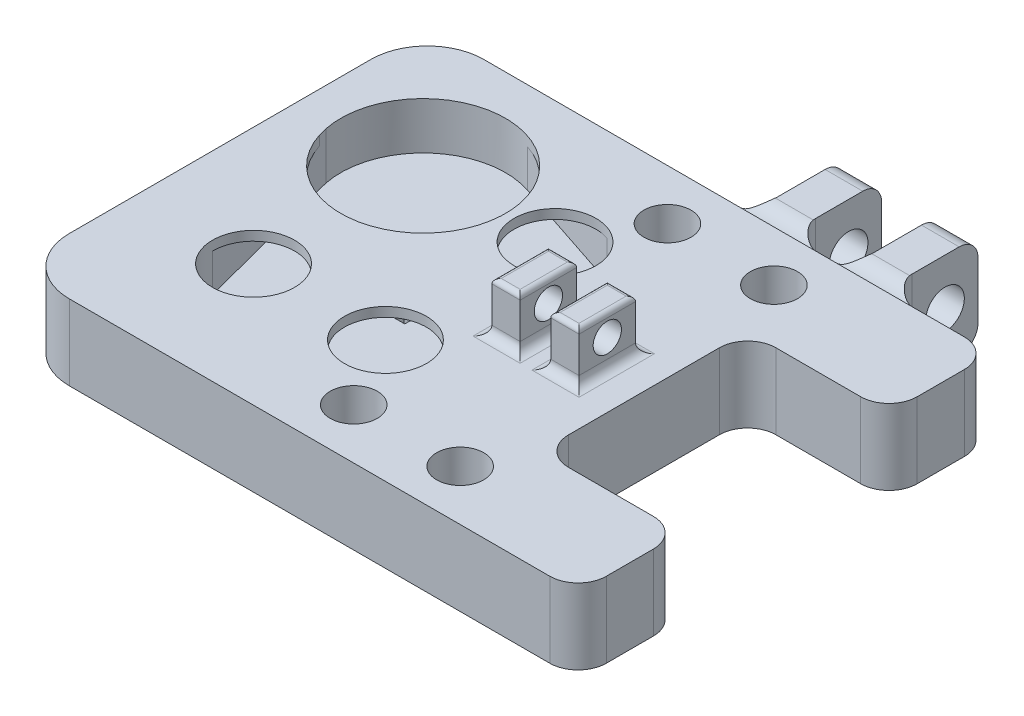
from build123d import *
from build123d.topology import SkipClean

# Parameters (mm, degrees)
SKETCH2_W                = 45
SKETCH2_H                = 22
BOSS_EXTRUDE1_DEPTH      = 8
SKETCH3_W                = 20
SKETCH3_H                = 3.02
CUT_EXTRUDE1_DEPTH       = 2
SKETCH11_R               = 2
CUT_EXTRUDE4_DEPTH       = 2
SKETCH19_W               = 3.117691909
SKETCH19_H               = 3.02
CUT_EXTRUDE5_DEPTH       = 3
SKETCH29_W               = 40
SKETCH29_H               = 11
BOSS_EXTRUDE6_DEPTH      = 8
SKETCH21_W               = 30
SKETCH21_H               = 36
CUT_EXTRUDE8_DEPTH       = 5
SKETCH24_W               = 30
SKETCH24_H               = 36
SKETCH24_R               = 4.35
SKETCH24_R_2             = 8.75
BOSS_EXTRUDE3_DEPTH      = 1
SKETCH25_W               = 3
SKETCH25_H               = 6
BOSS_EXTRUDE4_DEPTH      = 5.3
CUT_EXTRUDE9_REACH       = 51.695
SKETCH26_R               = 1.5
FILLET2_R                = 1
FILLET3_R                = 0.5
SKETCH27_W               = 20
SKETCH27_H               = 11
BOSS_EXTRUDE5_DEPTH      = 8
CUT_EXTRUDE10_REACH      = 54.386
SKETCH28_R               = 2.5
FILLET5_R                = 6
FILLET6_R                = 3
BOSS_EXTRUDE7_START      = -5
SKETCH30_W               = 30.600469098
SKETCH30_H               = 41.30937857
SKETCH30_R               = 2.5
BOSS_EXTRUDE7_DEPTH      = 5
SKETCH32_W               = 4
SKETCH32_H               = 10
BOSS_EXTRUDE8_DEPTH      = 9
CUT_EXTRUDE11_DEPTH      = 51.432817558
CUT_EXTRUDE11_DEPTH_BACK = 51.432817558
SKETCH34_R               = 2.05
FILLET7_R                = 2
FILLET8_DEPTH            = 7.999999573
FILLET8_START            = -1
FILLET8_2_DEPTH          = 10
FILLET8_START_2          = 18
FILLET8_3_DEPTH          = 20


with BuildPart() as part:
    # Sketch2 → Boss-Extrude1 (new body)
    with BuildSketch(Plane(origin=(0, 0, 0), x_dir=(1, 0, 0), z_dir=(0, 1, 0))):
        with Locations((8.076923077, 2.557692308)):
            Rectangle(SKETCH2_W, SKETCH2_H)
    extrude(amount=BOSS_EXTRUDE1_DEPTH)

    # Sketch3 → Cut-Extrude1 (cut)
    with BuildSketch(Plane.XZ):
        with Locations((13.576923077, -2.557692308)):
            Rectangle(SKETCH3_W, SKETCH3_H)
    extrude(amount=-CUT_EXTRUDE1_DEPTH, mode=Mode.SUBTRACT)

    # Sketch11 → Cut-Extrude4 (cut)
    with BuildSketch(Plane.XZ):
        with Locations((24.888372657, -2.557692308)):
            Circle(SKETCH11_R)
    extrude(amount=-CUT_EXTRUDE4_DEPTH, mode=Mode.SUBTRACT)

    # Sketch19 → Cut-Extrude5 (cut)
    with BuildSketch(Plane.XZ):
        with Locations((5.135769032, -2.557692308)):
            Rectangle(SKETCH19_W, SKETCH19_H)
    extrude(amount=-CUT_EXTRUDE5_DEPTH, mode=Mode.SUBTRACT)

    # Sketch29 → Boss-Extrude6 (add)
    with BuildSketch(Plane(origin=(0, 8, 0), x_dir=(1, 0, 0), z_dir=(0, 1, 0))):
        with Locations((5.576923077, 19.057692308)):
            Rectangle(SKETCH29_W, SKETCH29_H)
        with Locations((5.576923077, -13.942307692)):
            Rectangle(SKETCH29_W, SKETCH29_H)
    extrude(amount=-BOSS_EXTRUDE6_DEPTH)

    # Sketch21 → Cut-Extrude8 (cut)
    with BuildSketch(Plane.XZ.offset(-3)):
        with Locations((4.135769031, -2.557692308)):
            Rectangle(SKETCH21_W, SKETCH21_H)
    extrude(amount=-CUT_EXTRUDE8_DEPTH, mode=Mode.SUBTRACT)

    # Sketch24 → Boss-Extrude3 (add)
    with BuildSketch(Plane(origin=(0, 8, 0), x_dir=(1, 0, 0), z_dir=(0, 1, 0))):
        with Locations((4.135769031, 2.557692308)):
            Rectangle(SKETCH24_W, SKETCH24_H)
        with Locations(Location((12.135769031, 11.557692308, 0), (0, 0, 270))):
            Circle(SKETCH24_R, mode=Mode.SUBTRACT)
        with Locations(Location((-1.864230969, 11.557692308, 0), (0, 0, 270))):
            Circle(SKETCH24_R_2, mode=Mode.SUBTRACT)
        with Locations(Location((12.135769031, -6.442307692, 0), (0, 0, 270))):
            Circle(SKETCH24_R, mode=Mode.SUBTRACT)
        with Locations(Location((-1.864230969, -6.442307692, 0), (0, 0, 270))):
            Circle(SKETCH24_R, mode=Mode.SUBTRACT)
    extrude(amount=-BOSS_EXTRUDE3_DEPTH)

    # Sketch25 → Boss-Extrude4 (add)
    with BuildSketch(Plane(origin=(0, 8, 0), x_dir=(1, 0, 0), z_dir=(0, 1, 0))):
        with Locations((18.931923077, 2.557692308)):
            Rectangle(SKETCH25_W, SKETCH25_H)
        with Locations((25.181923077, 2.557692308)):
            Rectangle(SKETCH25_W, SKETCH25_H)
    extrude(amount=BOSS_EXTRUDE4_DEPTH)

    # Cut-Extrude9: up to this face of the body (flat: up to its plane)
    cut_extrude9_end = Plane(part.part.faces().sort_by_distance((17.431923077, 10.65, -2.557692308))[0])
    # Sketch26 → Cut-Extrude9 (cut, up to the picked face)
    with BuildSketch(Plane(origin=(26.681923077, 0, 0), x_dir=(0, 0, -1), z_dir=(1, 0, 0)), mode=Mode.PRIVATE) as cut_extrude9_sk1:
        with Locations((2.557692308, 11)):
            Circle(SKETCH26_R)
    cut_extrude9_tool1 = split(extrude(cut_extrude9_sk1.sketch, amount=-CUT_EXTRUDE9_REACH, mode=Mode.PRIVATE), bisect_by=cut_extrude9_end, keep=Keep.BOTH, mode=Mode.PRIVATE)
    add(cut_extrude9_tool1.solids().sort_by(Axis((26.681923, 11, -2.557692), (-1, 0, 0)))[0], mode=Mode.SUBTRACT)

    # Fillet2
    fillet2_edges = [part.edges().sort_by_distance(p)[0] for p in [
        (20.431923077, 8, -2.557692308),
        (18.931923077, 8, -5.557692308),
        (17.431923077, 8, -2.557692308),
        (18.931923077, 8, 0.442307692),
        (26.681923077, 8, -2.557692308),
        (25.181923077, 8, -5.557692308),
        (23.681923077, 8, -2.557692308),
        (25.181923077, 8, 0.442307692),
    ]]
    fillet(fillet2_edges, radius=FILLET2_R)

    # Fillet3
    fillet3_edges = [part.edges().sort_by_distance(p)[0] for p in [
        (17.431923077, 13.3, -2.557692308),
        (18.931923077, 13.3, 0.442307692),
        (20.431923077, 13.3, -2.557692308),
        (18.931923077, 13.3, -5.557692308),
        (23.681923077, 13.3, -2.557692308),
        (25.181923077, 13.3, 0.442307692),
        (26.681923077, 13.3, -2.557692308),
        (25.181923077, 13.3, -5.557692308),
    ]]
    fillet(fillet3_edges, radius=FILLET3_R)

    # Sketch27 → Boss-Extrude5 (add)
    with BuildSketch(Plane(origin=(0, 8, 0), x_dir=(1, 0, 0), z_dir=(0, 1, 0))):
        with Locations((35.576923077, 19.057692308)):
            Rectangle(SKETCH27_W, SKETCH27_H)
    boss_extrude5 = extrude(amount=-BOSS_EXTRUDE5_DEPTH)

    # Sketch28 → Cut-Extrude10 (cut, up to next)
    with BuildSketch(Plane(origin=(0, 8, 0), x_dir=(1, 0, 0), z_dir=(0, 1, 0)), mode=Mode.PRIVATE) as cut_extrude10_sk1:
        with Locations(Location((16.416923077, 19.207692308, 0), (0, 0, 270))):
            Circle(SKETCH28_R)
    cut_extrude10_tool1 = extrude(cut_extrude10_sk1.sketch, amount=-CUT_EXTRUDE10_REACH, mode=Mode.PRIVATE) & part.part
    # Sketch28 → Cut-Extrude10 (cut, up to next)
    with BuildSketch(Plane(origin=(0, 8, 0), x_dir=(1, 0, 0), z_dir=(0, 1, 0)), mode=Mode.PRIVATE) as cut_extrude10_sk2:
        with Locations(Location((27.716923077, 19.207692308, 0), (0, 0, 270))):
            Circle(SKETCH28_R)
    cut_extrude10_tool2 = extrude(cut_extrude10_sk2.sketch, amount=-CUT_EXTRUDE10_REACH, mode=Mode.PRIVATE) & part.part
    cut_extrude10_1 = cut_extrude10_tool1.solids().sort_by_distance((16.416923, 8, -19.207692))[0]
    add(cut_extrude10_1, mode=Mode.SUBTRACT)
    cut_extrude10_2 = cut_extrude10_tool2.solids().sort_by_distance((27.716923, 8, -19.207692))[0]
    add(cut_extrude10_2, mode=Mode.SUBTRACT)
    cut_extrude10 = cut_extrude10_1 + cut_extrude10_2  # Cut-Extrude10 as one shape, for the pattern or mirror that repeats it

    # Mirror1: Boss-Extrude5, Cut-Extrude10 across plane
    add(boss_extrude5.mirror(Plane.XY.offset(-2.557692308)))
    add(cut_extrude10.mirror(Plane.XY.offset(-2.557692308)), mode=Mode.SUBTRACT)

    # Fillet5
    fillet5_edges = [part.edges().sort_by_distance(p)[0] for p in [
        (-14.423076923, 4, -24.557692308),
        (-14.423076923, 4, 19.442307692),
    ]]
    fillet(fillet5_edges, radius=FILLET5_R)

    # Fillet6
    fillet6_edges = [part.edges().sort_by_distance(p)[0] for p in [
        (45.576923077, 4, -13.557692308),
        (45.576923077, 4, -24.557692308),
        (45.576923077, 4, 19.442307692),
        (45.576923077, 4, 8.442307692),
        (30.576923077, 4, -13.557692308),
        (30.576923077, 4, 8.442307692),
    ]]
    fillet(fillet6_edges, radius=FILLET6_R)

    # Sketch30 → Boss-Extrude7 (add)
    with SkipClean():  # the faces are left unmerged after this step: merging them gives an invalid solid
        with BuildSketch(Plane(origin=(0, 8, 0), x_dir=(1, 0, 0), z_dir=(0, 1, 0)).offset(BOSS_EXTRUDE7_START)):
            with Locations((4.108223654, 2.521201559)):
                Rectangle(SKETCH30_W, SKETCH30_H)
            with Locations(Location((16.416923077, -14.092307692, 0), (0, 0, 270))):
                Circle(SKETCH30_R, mode=Mode.SUBTRACT)
            with Locations(Location((16.416923077, 19.207692308, 0), (0, 0, 270))):
                Circle(SKETCH30_R, mode=Mode.SUBTRACT)
            with BuildLine():
                Line((-1.864230969, -10.792307692), (12.135769031, -10.792307692))
                ThreePointArc((12.135769031, -10.792307692), (15.21168353, -9.51822219), (16.485769031, -6.442307692))
                Line((16.485769031, -6.442307692), (16.485769031, 11.557692308))
                ThreePointArc((16.485769031, 11.557692308), (15.662068184, 14.104791498), (13.502911889, 15.687271028))
                Line((13.502911889, 15.687271028), (0.885769031, 19.864316171))
                ThreePointArc((0.885769031, 19.864316171), (-7.665778762, 18.107848275), (-10.44217516, 9.831026894))
                Line((-10.44217516, 9.831026894), (-6.214230969, -6.442307692))
                ThreePointArc((-6.214230969, -6.442307692), (-4.940145467, -9.51822219), (-1.864230969, -10.792307692))
            make_face(mode=Mode.SUBTRACT)
        extrude(amount=BOSS_EXTRUDE7_DEPTH)

    # Sketch32 → Boss-Extrude8 (add)
    with SkipClean():  # the faces are left unmerged after this step: merging them gives an invalid solid
        with BuildSketch(Plane(origin=(0, 0, -24.557692308), x_dir=(-1, 0, 0), z_dir=(0, 0, -1))):
            with Locations((-22.797093063, 4)):
                Rectangle(SKETCH32_W, SKETCH32_H)
            with Locations((-33.027093063, 4)):
                Rectangle(SKETCH32_W, SKETCH32_H)
        extrude(amount=BOSS_EXTRUDE8_DEPTH)

    # Sketch34 → Cut-Extrude11 (cut, two sides: drawn at the far end of the back side and taken through both)
    with SkipClean():  # the faces are left unmerged after this step: merging them gives an invalid solid
        with BuildSketch(Plane.ZY.offset(-20.797093063).offset(-CUT_EXTRUDE11_DEPTH_BACK)):
            with Locations((-30.057692308, 4)):
                Circle(SKETCH34_R)
        extrude(amount=CUT_EXTRUDE11_DEPTH + CUT_EXTRUDE11_DEPTH_BACK, mode=Mode.SUBTRACT)

    # Fillet7
    # the kernel refuses this fillet: 2 mm, written as the material it takes off along each edge
    with BuildSketch(Plane(origin=(39.357220082, -1, -24.557692308), x_dir=(0, 0, -1), z_dir=(-1, 0, 0))) as fillet7_piece_1:
        with BuildLine():
            CenterArc((1.732050808, -2), FILLET7_R, 90, 60)
            Line((0, -1), (-0.034641016, -0.98))
            ThreePointArc((-0.034641016, -0.98), (-0.04, -0.5), (-0.04, 0))
            Line((-0.04, 0), (0, 0.04))
            Line((0, 0.04), (1.732050808, 0.04))
            Line((1.732050808, 0.04), (1.732050808, 0))
        make_face()
    extrude(amount=12.660254038, mode=Mode.SUBTRACT)
    with BuildSketch(Plane(origin=(40.027093063, -1, -33.557692308), x_dir=(0, 1, 0), z_dir=(-1, 0, 0)), Plane(origin=(29.797093063, -1, -33.557692308), x_dir=(0, 1, 0), z_dir=(-1, 0, 0))) as fillet7_piece_2:
        with BuildLine():
            CenterArc((FILLET7_R, -FILLET7_R), FILLET7_R, 90, 90)
            Line((0, -FILLET7_R), (-FILLET7_R * 0.02, -FILLET7_R))
            Line((-FILLET7_R * 0.02, -FILLET7_R), (-FILLET7_R * 0.02, FILLET7_R * 0.02))
            Line((-FILLET7_R * 0.02, FILLET7_R * 0.02), (FILLET7_R, FILLET7_R * 0.02))
            Line((FILLET7_R, FILLET7_R * 0.02), (FILLET7_R, 0))
        make_face()
    extrude(amount=14, mode=Mode.SUBTRACT)
    with BuildSketch(Plane(origin=(26.696966044, 9, -24.557692308), x_dir=(0, -1, 0), z_dir=(1, 0, 0)), Plane(origin=(16.466966044, 9, -24.557692308), x_dir=(0, -1, 0), z_dir=(1, 0, 0)), Plane(origin=(29.127220082, -1, -24.557692308), x_dir=(0, 1, 0), z_dir=(-1, 0, 0))) as fillet7_piece_3:
        with BuildLine():
            CenterArc((2, 1.732050808), FILLET7_R, 180, 60)
            Line((0, 1.732050808), (-0.04, 1.732050808))
            Line((-0.04, 1.732050808), (-0.04, 0))
            Line((-0.04, 0), (0, -0.04))
            ThreePointArc((0, -0.04), (0.5, -0.04), (0.98, -0.034641016))
            Line((0.98, -0.034641016), (1, 0))
        make_face()
    extrude(amount=12.660254038, mode=Mode.SUBTRACT)
    with BuildSketch(Plane(origin=(26.027093063, 9, -33.557692308), x_dir=(0, 0, 1), z_dir=(1, 0, 0)), Plane(origin=(15.797093063, 9, -33.557692308), x_dir=(0, 0, 1), z_dir=(1, 0, 0))) as fillet7_piece_4:
        with BuildLine():
            CenterArc((FILLET7_R, FILLET7_R), FILLET7_R, 180, 90)
            Line((0, FILLET7_R), (-FILLET7_R * 0.02, FILLET7_R))
            Line((-FILLET7_R * 0.02, FILLET7_R), (-FILLET7_R * 0.02, -FILLET7_R * 0.02))
            Line((-FILLET7_R * 0.02, -FILLET7_R * 0.02), (FILLET7_R, -FILLET7_R * 0.02))
            Line((FILLET7_R, -FILLET7_R * 0.02), (FILLET7_R, 0))
        make_face()
    extrude(amount=14, mode=Mode.SUBTRACT)

    # Fillet8: read off the stored shape, not the designer's step
    # Fillet8 outline → Fillet8 (add)
    with BuildSketch(Plane(origin=(0, 0, 0), x_dir=(1, 0, 0), z_dir=(0, 1, 0))):
        with BuildLine():
            ThreePointArc((31.027093063, 26.557692308), (30.441306625, 25.143478745), (29.027093063, 24.557692308))
            Line((29.027093063, 24.557692308), (31.027093063, 24.557692308))
            Line((31.027093063, 24.557692308), (31.027093063, 26.557692308))
        make_face()
        with BuildLine():
            ThreePointArc((26.797093063, 24.557692308), (25.3828795, 25.143478746), (24.797093063, 26.557692308))
            Line((24.797093063, 26.557692308), (24.797093063, 24.557692308))
            Line((24.797093063, 24.557692308), (26.797093063, 24.557692308))
        make_face()
        with BuildLine():
            Line((35.027093063, 24.557692308), (37.027093063, 24.557692308))
            ThreePointArc((37.027093063, 24.557692308), (35.612879501, 25.143478745), (35.027093063, 26.557692308))
            Line((35.027093063, 26.557692308), (35.027093063, 24.557692308))
        make_face()
    extrude(amount=FILLET8_DEPTH)

    # Fillet8 2 outline → Fillet8 2 (add)
    with BuildSketch(Plane(origin=(0, 0, 0), x_dir=(1, 0, 0), z_dir=(0, 1, 0)).offset(FILLET8_START)):
        with BuildLine():
            Line((20.797093063, 24.557692308), (20.797093063, 26.557692308))
            ThreePointArc((20.797093063, 26.557692308), (20.211306625, 25.143478745), (18.797093063, 24.557692308))
            Line((18.797093063, 24.557692308), (20.797093063, 24.557692308))
        make_face()
        with BuildLine():
            ThreePointArc((31.027093063, 26.557692308), (30.441306625, 25.143478745), (29.027093063, 24.557692308))
            Line((29.027093063, 24.557692308), (31.027093063, 24.557692308))
            Line((31.027093063, 24.557692308), (31.027093063, 26.557692308))
        make_face()
        with BuildLine():
            ThreePointArc((26.797093063, 24.557692308), (25.3828795, 25.143478746), (24.797093063, 26.557692308))
            Line((24.797093063, 26.557692308), (24.797093063, 24.557692308))
            Line((24.797093063, 24.557692308), (26.797093063, 24.557692308))
        make_face()
        with BuildLine():
            Line((35.027093063, 24.557692308), (37.027093063, 24.557692308))
            ThreePointArc((37.027093063, 24.557692308), (35.612879501, 25.143478745), (35.027093063, 26.557692308))
            Line((35.027093063, 26.557692308), (35.027093063, 24.557692308))
        make_face()
    extrude(amount=FILLET8_2_DEPTH)

    # Fillet8 3 outline → Fillet8 3 (cut)
    with SkipClean():  # the faces are left unmerged after this step: merging them gives an invalid solid
        with BuildSketch(Plane.YZ.offset(FILLET8_START_2)):
            with BuildLine():
                Line((-1, -24.557692308), (-1, -26.289743115))
                ThreePointArc((-1, -26.289743115), (-0.732047858, -25.289738007), (1.0217e-05, -24.557686409))
                Line((1.0217e-05, -24.557686409), (-1, -24.557692308))
            make_face()
            with BuildLine():
                Line((9, -24.557692308), (7.999989783, -24.557686409))
                ThreePointArc((7.999989783, -24.557686409), (8.732047858, -25.289738007), (9, -26.289743115))
                Line((9, -26.289743115), (9, -24.557692308))
            make_face()
        extrude(amount=FILLET8_3_DEPTH, mode=Mode.SUBTRACT)


solid = part.part
